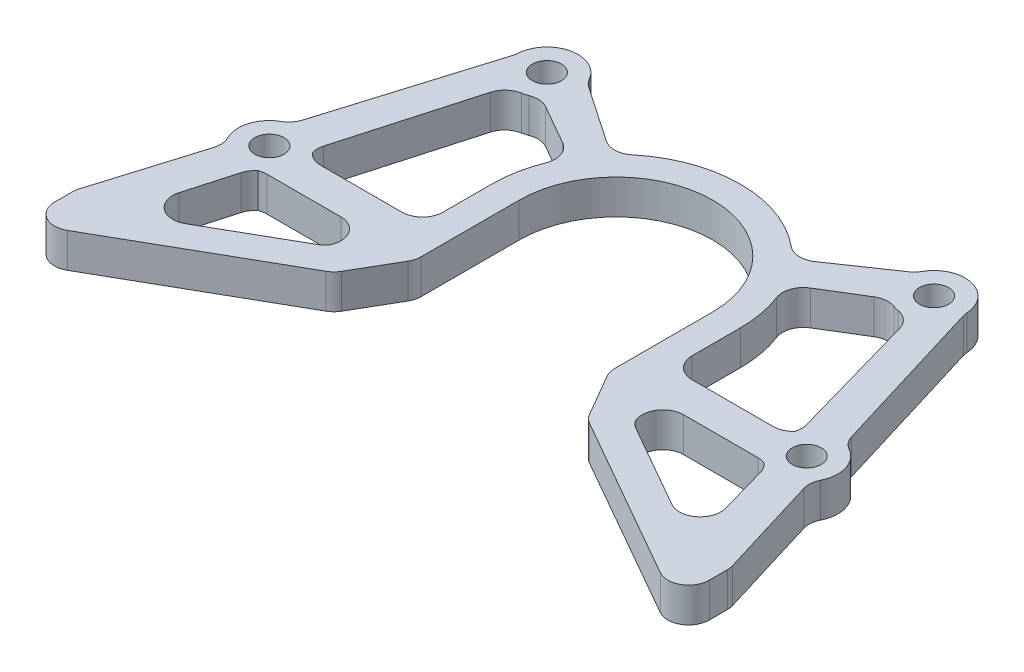
from build123d import *

# Parameters (mm, degrees)
SKETCH1_R           = 2.1
BOSS_EXTRUDE1_DEPTH = 5
FILLET1_R           = 3


with BuildPart() as part:
    # Sketch1 → Boss-Extrude1 (new body)
    with BuildSketch(Plane(origin=(0, 0, 0), x_dir=(1, 0, 0), z_dir=(0, 1, 0))):
        with BuildLine():
            Line((-13.108424678, 12.335688164), (-23.81391613, 19.651272793))
            ThreePointArc((-23.81391613, 19.651272793), (-28.840423282, 22.420824437), (-32.5, 18))
            Line((-32.5, 18), (-40.096022742, -6.956210733))
            ThreePointArc((-40.096022742, -6.956210733), (-43.166154305, -9.97313073), (-42.297472679, -14.188923219))
            Line((-42.297472679, -14.188923219), (-47.357175059, -30.812227694))
            Line((-47.357175059, -30.812227694), (-47.357175059, -39.030363151))
            Line((-47.357175059, -39.030363151), (-18.342946516, -22.477663327))
            Line((-18.342946516, -22.477663327), (-14, -15))
            Line((-14, -15), (-14, 0))
            ThreePointArc((-14, 0), (0, 14), (14, 0))
            Line((14, 0), (14, -15))
            Line((14, -15), (18.342946516, -22.477663327))
            Line((18.342946516, -22.477663327), (47.357175059, -39.030363151))
            Line((47.357175059, -39.030363151), (47.357175059, -30.812227694))
            Line((47.357175059, -30.812227694), (42.298924547, -14.193693231))
            ThreePointArc((42.298924547, -14.193693231), (43.172910541, -9.971638801), (40.094885373, -6.952473984))
            Line((40.094885373, -6.952473984), (32.5, 18))
            ThreePointArc((32.5, 18), (28.840423282, 22.420824437), (23.81391613, 19.651272793))
            Line((23.81391613, 19.651272793), (13.108424678, 12.335688164))
            ThreePointArc((13.108424678, 12.335688164), (0, 18), (-13.108424678, 12.335688164))
        make_face()
        with Locations(Location((-28, 18, 0), (0, 0, 270))):
            Circle(SKETCH1_R, mode=Mode.SUBTRACT)
        with Locations(Location((28, 18, 0), (0, 0, 270))):
            Circle(SKETCH1_R, mode=Mode.SUBTRACT)
        with Locations(Location((-38.861153282, -11.283461294, 0), (0, 0, 270))):
            Circle(SKETCH1_R, mode=Mode.SUBTRACT)
        with Locations(Location((38.867909518, -11.281969365, 0), (0, 0, 90))):
            Circle(SKETCH1_R, mode=Mode.SUBTRACT)
        with BuildLine():
            Line((-25.248239149, 14.439408445), (-15.625218329, 8.936025525))
            ThreePointArc((-15.625218329, 8.936025525), (-17.396176734, 4.623097992), (-18, 0))
            Line((-18, 0), (-18, -10))
            Line((-18, -10), (-34.548065396, -10))
            ThreePointArc((-34.548065396, -10), (-34.842334147, -9.258839659), (-35.262806272, -8.581258711))
            Line((-35.262806272, -8.581258711), (-28.978960053, 13.607775368))
            ThreePointArc((-28.978960053, 13.607775368), (-27.02091417, 13.607803404), (-25.248239149, 14.439408445))
        make_face(mode=Mode.SUBTRACT)
        with BuildLine():
            Line((25.248239149, 14.439408445), (15.784829627, 8.650962585))
            ThreePointArc((15.784829627, 8.650962585), (17.43741571, 4.46503453), (18, 0))
            Line((18, 0), (18, -10))
            Line((18, -10), (34.554377954, -10))
            ThreePointArc((34.554377954, -10), (34.846788526, -9.261923334), (35.264352488, -8.586718591))
            Line((35.264352488, -8.586718591), (28.978960053, 13.607775368))
            ThreePointArc((28.978960053, 13.607775368), (27.02091417, 13.607803404), (25.248239149, 14.439408445))
        make_face(mode=Mode.SUBTRACT)
        with BuildLine():
            Line((-41.532552131, -30.720502684), (-37.214001281, -15.471168338))
            ThreePointArc((-37.214001281, -15.471168338), (-36.75575967, -15.260560455), (-36.323961913, -15))
            Line((-36.323961913, -15), (-19.578578595, -15))
            Line((-19.578578595, -15), (-22.342946516, -19.759674693))
            Line((-22.342946516, -19.759674693), (-41.532552131, -30.720502684))
        make_face(mode=Mode.SUBTRACT)
        with BuildLine():
            Line((22.342946516, -19.759674693), (19.578578595, -15))
            Line((19.578578595, -15), (36.332904943, -15))
            ThreePointArc((36.332904943, -15), (36.759847211, -15.257654628), (37.212676027, -15.466488703))
            Line((37.212676027, -15.466488703), (41.532552131, -30.720502684))
            Line((41.532552131, -30.720502684), (22.342946516, -19.759674693))
        make_face(mode=Mode.SUBTRACT)
    extrude(amount=BOSS_EXTRUDE1_DEPTH)

    # Fillet1
    # the kernel refuses this fillet: 3 mm, written as the material it adds along each edge
    with BuildSketch(Plane(origin=(-23.81391613, 0, -19.651272793), x_dir=(0.8256386968680198, 0, 0.5641992043897953), z_dir=(0, 1, 0))) as fillet1_piece_1:
        with BuildLine():
            CenterArc((0.795468008, 3), FILLET1_R, 243.725731212, 26.274268788)
            ThreePointArc((-0.532537609, 0.309944038), (-0.26095765, 0.164097503), (0, 0))
            Line((0, 0), (0.795468008, 0))
        make_face()
    extrude(amount=5)
    with BuildSketch(Plane(origin=(23.81391613, 0, -19.651272793), x_dir=(0.42977558669909965, 0, -0.9029357369588629), z_dir=(0, 1, 0))) as fillet1_piece_2:
        with BuildLine():
            CenterArc((0.821555826, 2.992960971), FILLET1_R, 239.800020252, 26.274268788)
            Line((-0.687503097, 0.400136032), (0, 0))
            ThreePointArc((0, 0), (0.308083435, 0.010558543), (0.61616687, 0))
        make_face()
    extrude(amount=5)
    with BuildSketch(Plane(origin=(-25.248239149, 0, -14.439408445), x_dir=(0.8680676849209873, 0, 0.496445862502567), z_dir=(0, 1, 0))) as fillet1_piece_3:
        with BuildLine():
            CenterArc((1.668323511, -3), FILLET1_R, 90, 50.952492326)
            ThreePointArc((-0.66154814, -1.110106329), (-0.290717482, -0.578924176), (0, 0))
            Line((0, 0), (1.668323511, 0))
        make_face()
    extrude(amount=5)
    with BuildSketch(Plane(origin=(25.248239149, 0, -14.439408445), x_dir=(0.872925185444734, 0, 0.4878540976729382), z_dir=(0, 1, 0))) as fillet1_piece_4:
        with BuildLine():
            CenterArc((1.773419123, -2.967058567), FILLET1_R, 98.498581583, 52.153761346)
            Line((-0.841566624, -1.496735629), (0, 0))
            ThreePointArc((0, 0), (0.665032171, -0.04941215), (1.330064343, 0))
        make_face()
    extrude(amount=5)
    with BuildSketch(Plane(origin=(15.784829627, 0, -8.650962585), x_dir=(0.41941825768343016, 0, 0.9077931070027994), z_dir=(0, 1, 0))) as fillet1_piece_5:
        with BuildLine():
            CenterArc((2.671150004, 2.992955198), FILLET1_R, 186.654842848, 79.417835827)
            Line((-0.308636879, 2.64529137), (0, 0))
            ThreePointArc((0, 0), (1.232838463, 0.042268815), (2.465676926, 0))
        make_face()
    extrude(amount=5)
    with BuildSketch(Plane(origin=(-15.625218329, 0, -8.936025525), x_dir=(-0.8680676849209876, 0, -0.4964458625025664), z_dir=(0, 1, 0))) as fillet1_piece_6:
        with BuildLine():
            CenterArc((2.784609691, 3), FILLET1_R, 188.213210702, 81.786789298)
            ThreePointArc((-0.184620265, 2.571428571), (-0.046214393, 1.289023811), (0, 0))
            Line((0, 0), (2.784609691, 0))
        make_face()
    extrude(amount=5)
    with BuildSketch(Plane(origin=(-22.342946516, 0, 19.759674693), x_dir=(0.5022287001852431, 0, -0.8647348337555515), z_dir=(0, 1, 0))) as fillet1_piece_7:
        with BuildLine():
            CenterArc((FILLET1_R * 0.269053653144, FILLET1_R), FILLET1_R, 239.881948801, 30.118051199)
            Line((-FILLET1_R * 0.232729627554, FILLET1_R * 0.135006624758), (0, 0))
            Line((0, 0), (FILLET1_R * 0.269053653144, 0))
        make_face()
    extrude(amount=5)
    with BuildSketch(Plane(origin=(-32.5, 0, -18), x_dir=(0.033460432753213476, 0, -0.9994400429440315), z_dir=(0, 1, 0))) as fillet1_piece_8:
        with BuildLine():
            CenterArc((0.401525193, 2.998320129), FILLET1_R, 254.988611701, 13.093888803)
            Line((-0.375507899, 0.100697038), (0, 0))
            ThreePointArc((0, 0), (0.150571947, 0.002519807), (0.301143895, 0))
        make_face()
    extrude(amount=5)
    with BuildSketch(Plane(origin=(-13.108424678, 0, -12.335688164), x_dir=(-0.8256386968680209, 0, -0.5641992043897939), z_dir=(0, 1, 0))) as fillet1_piece_9:
        with BuildLine():
            CenterArc((2.403694147, -3), FILLET1_R, 90, 73.99808624)
            ThreePointArc((-0.480063319, -2.172991611), (-0.206417918, -1.093921846), (0, 0))
            Line((0, 0), (2.403694147, 0))
        make_face()
    extrude(amount=5)
    with BuildSketch(Plane(origin=(13.108424678, 0, -12.335688164), x_dir=(0.8256386968680193, 0, -0.564199204389796), z_dir=(0, 1, 0))) as fillet1_piece_10:
        with BuildLine():
            CenterArc((2.403694147, 3), FILLET1_R, 196.00191376, 73.99808624)
            ThreePointArc((-0.480063319, 2.172991611), (-0.206417918, 1.093921846), (0, 0))
            Line((0, 0), (2.403694147, 0))
        make_face()
    extrude(amount=5)
    with BuildSketch(Plane(origin=(32.5, 0, -18), x_dir=(0.29118456974575907, 0, 0.9566668941392178), z_dir=(0, 1, 0))) as fillet1_piece_11:
        with BuildLine():
            CenterArc((0.388775096, 3), FILLET1_R, 256.906111197, 13.093888803)
            ThreePointArc((-0.290867168, 0.077999591), (-0.144780926, 0.041433612), (0, 0))
            Line((0, 0), (0.388775096, 0))
        make_face()
    extrude(amount=5)
    with BuildSketch(Plane(origin=(-28.978960053, 0, -13.607775368), x_dir=(-0.27248027384086115, 0, 0.9621613691931357), z_dir=(0, 1, 0))) as fillet1_piece_12:
        with BuildLine():
            CenterArc((2.264129599, 3), FILLET1_R, 205.720636607, 64.279363393)
            ThreePointArc((-0.438632708, 1.69804919), (-0.13579309, 0.870599963), (0, 0))
            Line((0, 0), (2.264129599, 0))
        make_face()
    extrude(amount=5)
    with BuildSketch(Plane(origin=(-18, 0, 10), x_dir=(0, 0, -1), z_dir=(0, 1, 0)), Plane(origin=(18, 0, 10), x_dir=(1, 0, 0), z_dir=(0, 1, 0))) as fillet1_piece_13:
        with BuildLine():
            CenterArc((FILLET1_R, FILLET1_R), FILLET1_R, 180, 90)
            Line((0, FILLET1_R), (0, 0))
            Line((0, 0), (FILLET1_R, 0))
        make_face()
    extrude(amount=5)
    with BuildSketch(Plane(origin=(19.578578595, 0, 15), x_dir=(0.5022287001852463, 0, 0.8647348337555496), z_dir=(0, 1, 0)), Plane(origin=(-19.578578595, 0, 15), x_dir=(-1, 0, 0), z_dir=(0, 1, 0))) as fillet1_piece_14:
        with BuildLine():
            CenterArc((FILLET1_R * 1.73721312192, FILLET1_R), FILLET1_R, 149.852440516, 120.147559484)
            Line((FILLET1_R * 0.872478288169, FILLET1_R * 1.50222870019), (0, 0))
            Line((0, 0), (FILLET1_R * 1.73721312192, 0))
        make_face()
    extrude(amount=5)
    with BuildSketch(Plane(origin=(28.978960053, 0, -13.607775368), x_dir=(-0.9997313516905528, 0, 0.02317810274764039), z_dir=(0, 1, 0))) as fillet1_piece_15:
        with BuildLine():
            CenterArc((2.338382994, 2.94249007), FILLET1_R, 194.483784652, 64.279363393)
            Line((-0.566272391, 2.192172078), (0, 0))
            ThreePointArc((0, 0), (0.876893623, 0.086264895), (1.753787246, 0))
        make_face()
    extrude(amount=5)
    with BuildSketch(Plane(origin=(-42.297472679, 0, 14.188923219), x_dir=(-0.550292568661387, 0, -0.8349719090341021), z_dir=(0, 1, 0))) as fillet1_piece_16:
        with BuildLine():
            CenterArc((1.426661501, 2.978722849), FILLET1_R, 219.684025488, 43.488017804)
            Line((-0.882071355, 1.063063015), (0, 0))
            ThreePointArc((0, 0), (0.534998063, 0.031915727), (1.069996126, 0))
        make_face()
    extrude(amount=5)
    with BuildSketch(Plane(origin=(-40.096022742, 0, 6.956210733), x_dir=(0.29118456974575413, 0, -0.9566668941392192), z_dir=(0, 1, 0))) as fillet1_piece_17:
        with BuildLine():
            CenterArc((1.381359058, 3), FILLET1_R, 226.511982196, 43.488017804)
            ThreePointArc((-0.683249534, 0.82344507), (-0.317063138, 0.432102427), (0, 0))
            Line((0, 0), (1.381359058, 0))
        make_face()
    extrude(amount=5)
    with BuildSketch(Plane(origin=(40.094885373, 0, 6.952473984), x_dir=(0.922776111721525, 0, 0.3853365381534742), z_dir=(0, 1, 0))) as fillet1_piece_18:
        with BuildLine():
            CenterArc((1.429570008, 2.978635694), FILLET1_R, 219.593522345, 43.564534449)
            Line((-0.8821859, 1.066625072), (0, 0))
            ThreePointArc((0, 0), (0.536088753, 0.032046458), (1.072177506, 0))
        make_face()
    extrude(amount=5)
    with BuildSketch(Plane(origin=(42.298924547, 0, 14.193693231), x_dir=(0.29118456974575607, 0, 0.9566668941392186), z_dir=(0, 1, 0))) as fillet1_piece_19:
        with BuildLine():
            CenterArc((1.384175208, 3), FILLET1_R, 226.435465551, 43.564534449)
            ThreePointArc((-0.68333826, 0.826204228), (-0.3169746, 0.433526504), (0, 0))
            Line((0, 0), (1.384175208, 0))
        make_face()
    extrude(amount=5)
    with BuildSketch(Plane(origin=(37.212676027, 0, 15.466488703), x_dir=(-0.884494678117859, 0, -0.4665502806570641), z_dir=(0, 1, 0))) as fillet1_piece_20:
        with BuildLine():
            CenterArc((1.301982556, 2.982289823), FILLET1_R, 223.622510824, 40.148718597)
            Line((-0.869720031, 0.912577796), (0, 0))
            ThreePointArc((0, 0), (0.488243459, 0.026565265), (0.976486917, 0))
        make_face()
    extrude(amount=5)
    with BuildSketch(Plane(origin=(36.332904943, 0, 15), x_dir=(-1, 0, 0), z_dir=(0, 1, 0))) as fillet1_piece_21:
        with BuildLine():
            CenterArc((0.799371586, 3), FILLET1_R, 243.603306461, 26.396693539)
            ThreePointArc((-0.534378878, 0.312787746), (-0.261803191, 0.165595952), (0, 0))
            Line((0, 0), (0.799371586, 0))
        make_face()
    extrude(amount=5)
    with BuildSketch(Plane(origin=(22.342946516, 0, 19.759674693), x_dir=(-0.5022287001852482, 0, -0.8647348337555484), z_dir=(0, 1, 0))) as fillet1_piece_22:
        with BuildLine():
            CenterArc((FILLET1_R * 0.269053653144, -FILLET1_R), FILLET1_R, 90, 30.118051199)
            Line((-FILLET1_R * 0.232729627554, -FILLET1_R * 0.135006624758), (0, 0))
            Line((0, 0), (FILLET1_R * 0.269053653144, 0))
        make_face()
    extrude(amount=5)
    with BuildSketch(Plane(origin=(41.532552131, 0, 30.720502684), x_dir=(-0.27248027384086354, 0, -0.9621613691931349), z_dir=(0, 1, 0))) as fillet1_piece_23:
        with BuildLine():
            CenterArc((FILLET1_R * 2.44714649084, FILLET1_R), FILLET1_R, 134.453699631, 135.546300369)
            Line((FILLET1_R * 1.74681382865, FILLET1_R * 1.7138166167), (0, 0))
            Line((0, 0), (FILLET1_R * 2.44714649084, 0))
        make_face()
    extrude(amount=5)
    with BuildSketch(Plane(origin=(34.554377954, 0, 10), x_dir=(0.4333984006716721, 0, -0.90120243358262), z_dir=(0, 1, 0))) as fillet1_piece_24:
        with BuildLine():
            CenterArc((1.904436719, 2.961979076), FILLET1_R, 205.683425336, 55.184949463)
            Line((-0.799170582, 1.661783874), (0, 0))
            ThreePointArc((0, 0), (0.714163769, 0.057031385), (1.428327539, 0))
        make_face()
    extrude(amount=5)
    with BuildSketch(Plane(origin=(35.264352488, 0, 8.586718591), x_dir=(-0.27248027384086226, 0, -0.9621613691931352), z_dir=(0, 1, 0))) as fillet1_piece_25:
        with BuildLine():
            CenterArc((1.260639189, 3), FILLET1_R, 229.851281403, 40.148718597)
            ThreePointArc((-0.673682239, 0.706879721), (-0.317610501, 0.371767344), (0, 0))
            Line((0, 0), (1.260639189, 0))
        make_face()
    extrude(amount=5)
    with BuildSketch(Plane(origin=(-35.262806272, 0, 8.581258711), x_dir=(0.509969050101938, 0, 0.8601927504566212), z_dir=(0, 1, 0))) as fillet1_piece_26:
        with BuildLine():
            CenterArc((1.304985241, 2.982207797), FILLET1_R, 223.526320741, 40.230486582)
            Line((-0.870188986, 0.916144613), (0, 0))
            ThreePointArc((0, 0), (0.489369465, 0.026688304), (0.978738931, 0))
        make_face()
    extrude(amount=5)
    with BuildSketch(Plane(origin=(-34.548065396, 0, 10), x_dir=(1, 0, 0), z_dir=(0, 1, 0))) as fillet1_piece_27:
        with BuildLine():
            CenterArc((1.843368835, 3), FILLET1_R, 214.828934175, 55.171065825)
            ThreePointArc((-0.619213853, 1.286615483), (-0.258250696, 0.668024131), (0, 0))
            Line((0, 0), (1.843368835, 0))
        make_face()
    extrude(amount=5)
    with BuildSketch(Plane(origin=(-36.323961913, 0, 15), x_dir=(-0.8627664666519094, 0, 0.5056026345075543), z_dir=(0, 1, 0))) as fillet1_piece_28:
        with BuildLine():
            CenterArc((0.826431657, 2.992877072), FILLET1_R, 239.628635242, 26.422318342)
            Line((-0.690376246, 0.404577672), (0, 0))
            ThreePointArc((0, 0), (0.309911872, 0.010684392), (0.619823743, 0))
        make_face()
    extrude(amount=5)
    with BuildSketch(Plane(origin=(-41.532552131, 0, 30.720502684), x_dir=(0.272480273840862, 0, -0.9621613691931352), z_dir=(0, 1, 0))) as fillet1_piece_29:
        with BuildLine():
            CenterArc((FILLET1_R * 2.44714649084, -FILLET1_R), FILLET1_R, 90, 135.546300369)
            Line((FILLET1_R * 1.74681382865, -FILLET1_R * 1.7138166167), (0, 0))
            Line((0, 0), (FILLET1_R * 2.44714649084, 0))
        make_face()
    extrude(amount=5)
    with BuildSketch(Plane(origin=(-37.214001281, 0, 15.471168338), x_dir=(-0.2724802738408629, 0, 0.9621613691931351), z_dir=(0, 1, 0))) as fillet1_piece_30:
        with BuildLine():
            CenterArc((1.263546526, 3), FILLET1_R, 229.769513418, 40.230486582)
            ThreePointArc((-0.67404549, 0.709642566), (-0.317672175, 0.37320119), (0, 0))
            Line((0, 0), (1.263546526, 0))
        make_face()
    extrude(amount=5)
    # the kernel refuses this fillet: 3 mm, written as the material it takes off along each edge
    with BuildSketch(Plane(origin=(47.357175059, -12.913462036, 39.030363151), x_dir=(-0.8685893031239024, 0, -0.4955326654204883), z_dir=(0, 1, 0)), Plane(origin=(-47.357175059, -12.913462036, 39.030363151), x_dir=(0, 0, -1), z_dir=(0, 1, 0))) as fillet1_2_piece_1:
        with BuildLine():
            CenterArc((FILLET1_R * 1.72179493812, -FILLET1_R), FILLET1_R, 90, 119.704881032)
            Line((FILLET1_R * 0.853205634992, -FILLET1_R * 1.49553266542), (0, 0))
            Line((0, 0), (FILLET1_R * 1.72179493812, 0))
        make_face()
    extrude(amount=30.826924072, mode=Mode.SUBTRACT)
    with BuildSketch(Plane(origin=(18.342946516, -2.019973662, 22.477663327), x_dir=(-0.5022287001852438, 0, -0.8647348337555512), z_dir=(0, 1, 0)), Plane(origin=(14, -2.019973662, 15), x_dir=(0, 0, -1), z_dir=(0, 1, 0)), Plane(origin=(-18.342946516, -2.019973662, 22.477663327), x_dir=(-0.8685893031239008, 0, 0.49553266542049107), z_dir=(0, 1, 0)), Plane(origin=(-14, -2.019973662, 15), x_dir=(-0.5022287001852443, 0, 0.8647348337555507), z_dir=(0, 1, 0))) as fillet1_2_piece_2:
        with BuildLine():
            CenterArc((FILLET1_R * 0.269329821642, -FILLET1_R), FILLET1_R, 90, 30.147559484)
            Line((-FILLET1_R * 0.232898878543, -FILLET1_R * 0.135265166244), (0, 0))
            Line((0, 0), (FILLET1_R * 0.269329821642, 0))
        make_face()
    extrude(amount=9.039947325, mode=Mode.SUBTRACT)
    with BuildSketch(Plane(origin=(47.357175059, -1.116124712, 30.812227694), x_dir=(0, 0, 1), z_dir=(0, 1, 0)), Plane(origin=(-47.357175059, -1.116124712, 30.812227694), x_dir=(0.29118456974575035, 0, -0.9566668941392203), z_dir=(0, 1, 0))) as fillet1_2_piece_3:
        with BuildLine():
            CenterArc((FILLET1_R * 0.148816628225, -FILLET1_R), FILLET1_R, 90, 16.928887796)
            Line((-FILLET1_R * 0.142367941521, -FILLET1_R * 0.0433331058608), (0, 0))
            Line((0, 0), (FILLET1_R * 0.148816628225, 0))
        make_face()
    extrude(amount=7.232249423, mode=Mode.SUBTRACT)


solid = part.part
